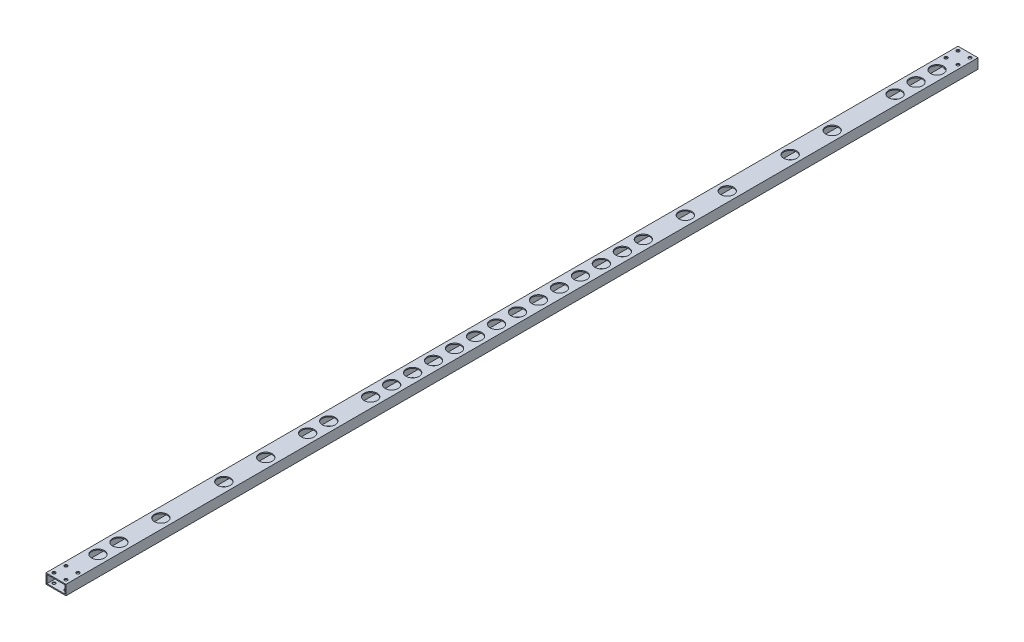
from build123d import *

# Parameters (mm, degrees)
SKETCH_1_W          = 20
SKETCH_1_H          = 10
SKETCH_1_W_2        = 18
SKETCH_1_H_2        = 8
EXTRUDE_1_DEPTH     = 913
SKETCH_3_R          = 6.5
CUT_EXTRUDE_2_DEPTH = 914.273781514
SKETCH_4_R          = 1.575
CUT_EXTRUDE_3_DEPTH = 914.273781514


with BuildPart() as part:
    # 草图1 → 凸台-拉伸1 (new body)
    with BuildSketch(Plane.XY):
        with Locations((10, 5)):
            Rectangle(SKETCH_1_W, SKETCH_1_H)
        with Locations((10, 5)):
            Rectangle(SKETCH_1_W_2, SKETCH_1_H_2, mode=Mode.SUBTRACT)
    extrude(amount=EXTRUDE_1_DEPTH)

    # 草图3 → 切除-拉伸2 (cut, through all)
    with BuildSketch(Plane(origin=(0, 10, 0), x_dir=(1, 0, 0), z_dir=(0, 1, 0))):
        with Locations((10, -31)):
            Circle(SKETCH_3_R)
        with Locations((10, -52)):
            Circle(SKETCH_3_R)
        with Locations((10, -73)):
            Circle(SKETCH_3_R)
        with Locations((10, -136)):
            Circle(SKETCH_3_R)
        with Locations((10, -178)):
            Circle(SKETCH_3_R)
        with Locations((10, -241)):
            Circle(SKETCH_3_R)
        with Locations((10, -283)):
            Circle(SKETCH_3_R)
        with Locations((10, -325)):
            Circle(SKETCH_3_R)
        with Locations((10, -346)):
            Circle(SKETCH_3_R)
        with Locations((10, -367)):
            Circle(SKETCH_3_R)
        with Locations((10, -388)):
            Circle(SKETCH_3_R)
        with Locations((10, -409)):
            Circle(SKETCH_3_R)
        with Locations((10, -430)):
            Circle(SKETCH_3_R)
        with Locations((10, -451)):
            Circle(SKETCH_3_R)
        with Locations((10, -472)):
            Circle(SKETCH_3_R)
        with Locations((10, -493)):
            Circle(SKETCH_3_R)
        with Locations((10, -514)):
            Circle(SKETCH_3_R)
        with Locations((10, -535)):
            Circle(SKETCH_3_R)
        with Locations((10, -556)):
            Circle(SKETCH_3_R)
        with Locations((10, -577)):
            Circle(SKETCH_3_R)
        with Locations((10, -598)):
            Circle(SKETCH_3_R)
        with Locations((10, -640)):
            Circle(SKETCH_3_R)
        with Locations((10, -661)):
            Circle(SKETCH_3_R)
        with Locations((10, -703)):
            Circle(SKETCH_3_R)
        with Locations((10, -745)):
            Circle(SKETCH_3_R)
        with Locations((10, -808)):
            Circle(SKETCH_3_R)
        with Locations((10, -850)):
            Circle(SKETCH_3_R)
        with Locations((10, -871)):
            Circle(SKETCH_3_R)
    extrude(amount=-CUT_EXTRUDE_2_DEPTH, mode=Mode.SUBTRACT)

    # 草图4 → 切除-拉伸3 (cut, through all)
    with BuildSketch(Plane(origin=(0, 10, 0), x_dir=(1, 0, 0), z_dir=(0, 1, 0))):
        with Locations((16, -909)):
            Circle(SKETCH_4_R)
        with Locations((4, -909)):
            Circle(SKETCH_4_R)
        with Locations((4, -897)):
            Circle(SKETCH_4_R)
        with Locations((16, -897)):
            Circle(SKETCH_4_R)
        with Locations((16, -4)):
            Circle(SKETCH_4_R)
        with Locations((4, -4)):
            Circle(SKETCH_4_R)
        with Locations((4, -16)):
            Circle(SKETCH_4_R)
        with Locations((16, -16)):
            Circle(SKETCH_4_R)
    extrude(amount=-CUT_EXTRUDE_3_DEPTH, mode=Mode.SUBTRACT)


solid = part.part
